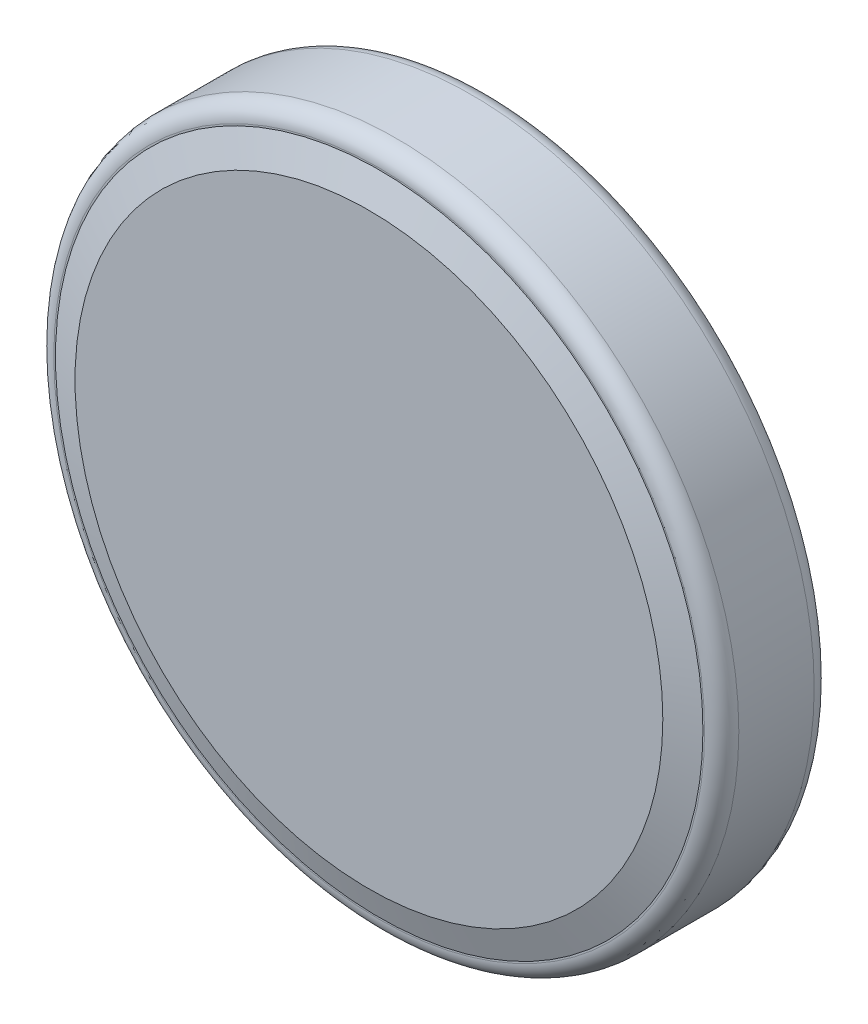
from build123d import *

# Parameters (mm, degrees)
SKETCH1_R           = 10
BOSS_EXTRUDE1_DEPTH = 3.2
SKETCH2_R           = 8
BOSS_EXTRUDE2_DEPTH = 0.3
CHAMFER1_SIZE       = 1.452105439
CHAMFER1_SIZE_2     = 0.5
SKETCH3_W           = 2.2
SKETCH3_H           = 0.6
SKETCH3_W_2         = 0.6
SKETCH3_H_2         = 2.2
CUT_EXTRUDE1_DEPTH  = 0.1
CUT_EXTRUDE2_DEPTH  = 0.1
FILLET1_R           = 0.5


with BuildPart() as part:
    # Sketch1 → Boss-Extrude1 (new body)
    with BuildSketch(Plane.XY):
        Circle(SKETCH1_R)
    extrude(amount=BOSS_EXTRUDE1_DEPTH)

    # Sketch2 → Boss-Extrude2 (add)
    with BuildSketch(Plane.XY.offset(3.2)):
        Circle(SKETCH2_R)
    extrude(amount=BOSS_EXTRUDE2_DEPTH)

    # Chamfer1
    # the kernel refuses this chamfer: 1.452105439, 0.5 mm, written as the material it adds along each edge
    with BuildSketch(Plane(origin=(0, 0, 3.2), x_dir=(1, 0, 0), z_dir=(0, -1, 0))) as chamfer1_piece_1_section:
        Polygon((8 + CHAMFER1_SIZE, 0), (8, CHAMFER1_SIZE_2), (8, 0), align=None)
    chamfer1_piece_1 = revolve(axis=Axis((0, 0, 3.2), (0, 0, 1)), mode=Mode.PRIVATE)
    chamfer1_piece_1 = split(chamfer1_piece_1, bisect_by=Plane(origin=(-9.03518169, 0, 3.5), z_dir=(0, 0, -1)), keep=Keep.TOP, mode=Mode.PRIVATE)
    add(chamfer1_piece_1)

    # Sketch3 → Cut-Extrude1 (cut)
    with BuildSketch(Plane(origin=(0, 0, 0), x_dir=(-1, 0, 0), z_dir=(0, 0, -1))):
        with Locations((1.4, 6)):
            Rectangle(SKETCH3_W, SKETCH3_H)
        with Locations((0, 7.4)):
            Rectangle(SKETCH3_W_2, SKETCH3_H_2)
        with Locations((-1.4, 6)):
            Rectangle(SKETCH3_W, SKETCH3_H)
        with Locations((0, 6)):
            Rectangle(SKETCH3_W_2, SKETCH3_H)
        with Locations((0, 4.6)):
            Rectangle(SKETCH3_W_2, SKETCH3_H_2)
    extrude(amount=-CUT_EXTRUDE1_DEPTH, mode=Mode.SUBTRACT)

    # Sketch5 → Cut-Extrude2 (cut)
    # profile 1 of 8: a face of its own
    with BuildSketch(Plane(origin=(0, 0, 0), x_dir=(-1, 0, 0), z_dir=(0, 0, -1))):
        with BuildLine():
            Line((-5.16025641, 1.397039927), (-5.435096154, 1.186703389))
            add(Edge.make_bspline(
                [(-5.435096154, 1.186703389), (-5.454702042, 1.210069358), (-5.493649489, 1.256486274), (-5.556308692, 1.321665819), (-5.621610334, 1.38273108), (-5.689529456, 1.43997296), (-5.761288575, 1.491389725), (-5.835149374, 1.539660828), (-5.912347419, 1.582928566), (-6.019099154, 1.635391552), (-6.158747002, 1.690137707), (-6.334541841, 1.736040939), (-6.51805294, 1.765262114), (-6.643250539, 1.768426956), (-6.70693109, 1.770036722)],
                knots=[0, 0, 0, 0, 0.757959112, 1.505699292, 2.245454638, 2.979532153, 3.711538275, 4.438200793, 5.171680507, 5.909471876, 7.393775596, 8.890124382, 10.418191784, 12, 12, 12, 12], degree=3))
            add(Edge.make_bspline(
                [(-6.70693109, 1.770036722), (-6.742014389, 1.769632759), (-6.811855382, 1.768828584), (-6.915503855, 1.758219458), (-7.017216906, 1.743308248), (-7.116928373, 1.721182925), (-7.214511331, 1.693210306), (-7.310603733, 1.659784892), (-7.403814333, 1.618430052), (-7.495432571, 1.572721792), (-7.583211782, 1.521094348), (-7.66626683, 1.464780996), (-7.744294798, 1.404411899), (-7.81735741, 1.339760793), (-7.885529358, 1.271118832), (-7.948316669, 1.197754491), (-8.005502079, 1.119902317), (-8.058219104, 1.03858891), (-8.105431838, 0.954051118), (-8.144961717, 0.865976048), (-8.179966839, 0.775871945), (-8.207666082, 0.682720784), (-8.229590599, 0.587178018), (-8.244718262, 0.48898723), (-8.255206733, 0.38835355), (-8.25600691, 0.320144238), (-8.256410256, 0.285761882)],
                knots=[0, 0, 0, 0, 1.054917814, 2.100044995, 3.131103042, 4.146048494, 5.169673617, 6.183595914, 7.203665975, 8.234915748, 9.262203917, 10.264457458, 11.251630812, 12.227803204, 13.197192746, 14.159520551, 15.12972552, 16.100847026, 17.073214652, 18.039054194, 19.002613845, 19.979014051, 20.95965708, 21.949030935, 22.966165397, 24, 24, 24, 24], degree=3))
            add(Edge.make_bspline(
                [(-8.256410256, 0.285761882), (-8.255148437, 0.234030562), (-8.252671023, 0.132462977), (-8.230622689, -0.016307633), (-8.197117598, -0.158828307), (-8.146902021, -0.294208149), (-8.08498297, -0.424116507), (-8.006742359, -0.546355361), (-7.916125821, -0.662771925), (-7.811851402, -0.770614873), (-7.697445586, -0.869128598), (-7.574697674, -0.95587918), (-7.443913387, -1.028194062), (-7.306536756, -1.088370009), (-7.161510642, -1.134626736), (-7.00909584, -1.16719086), (-6.849623845, -1.18843304), (-6.740654445, -1.190466728), (-6.685196314, -1.19150174)],
                knots=[0, 0, 0, 0, 1.029171465, 2.020641659, 2.987623507, 3.938342917, 4.889210282, 5.84687017, 6.821220943, 7.821438502, 8.827599549, 9.822697543, 10.807740252, 11.797342354, 12.80366471, 13.83203677, 14.896651826, 16, 16, 16, 16], degree=3))
            add(Edge.make_bspline(
                [(-6.685196314, -1.19150174), (-6.624093625, -1.18981296), (-6.503828916, -1.186489037), (-6.32746089, -1.158329788), (-6.158625124, -1.11267187), (-5.997312538, -1.048773948), (-5.843977891, -0.96570866), (-5.698381231, -0.865010783), (-5.560399661, -0.74572245), (-5.477428378, -0.654639322), (-5.435096154, -0.608168406)],
                knots=[0, 0, 0, 0, 1.028121516, 2.023589091, 2.998037872, 3.967518031, 4.937445131, 5.927275754, 6.942489185, 8, 8, 8, 8], degree=3))
            Line((-5.435096154, -0.608168406), (-5.16025641, -0.816401579))
            add(Edge.make_bspline(
                [(-5.16025641, -0.816401579), (-5.18237452, -0.844940031), (-5.226504795, -0.901880238), (-5.297962812, -0.982151947), (-5.37324011, -1.057655983), (-5.45289582, -1.127783604), (-5.536013611, -1.19393807), (-5.624085924, -1.254239901), (-5.715954956, -1.309530785), (-5.811309435, -1.36015771), (-5.910048048, -1.405074957), (-6.012052483, -1.443528724), (-6.116883058, -1.476653614), (-6.224544567, -1.503905551), (-6.335260324, -1.525176635), (-6.448630798, -1.539396309), (-6.564900673, -1.549138224), (-6.643342094, -1.55002614), (-6.683092949, -1.550476099)],
                knots=[0, 0, 0, 0, 0.986787822, 1.968848986, 2.935600012, 3.899624008, 4.868462664, 5.837806735, 6.815139263, 7.798259679, 8.787526145, 9.778297419, 10.776456485, 11.791383307, 12.812564526, 13.85620153, 14.913611965, 16, 16, 16, 16], degree=3))
            add(Edge.make_bspline(
                [(-6.683092949, -1.550476099), (-6.720736616, -1.550214106), (-6.795172306, -1.549696048), (-6.905071057, -1.541303881), (-7.012060638, -1.529854144), (-7.115835264, -1.512614013), (-7.216961239, -1.492269673), (-7.314521824, -1.464998416), (-7.409477034, -1.434449249), (-7.501445375, -1.398544263), (-7.590505075, -1.35802808), (-7.676368886, -1.312236521), (-7.758997318, -1.261554657), (-7.839202739, -1.207099646), (-7.915800323, -1.147122344), (-7.989453848, -1.08245571), (-8.060576324, -1.013317699), (-8.104579009, -0.963462846), (-8.126702724, -0.938396772)],
                knots=[0, 0, 0, 0, 1.114604814, 2.203992996, 3.262667896, 4.300477797, 5.318619304, 6.316056647, 7.298880507, 8.271930387, 9.238335007, 10.195173496, 11.151986948, 12.108099108, 13.064862484, 14.031167946, 15.010108607, 16, 16, 16, 16], degree=3))
            add(Edge.make_bspline(
                [(-8.126702724, -0.938396772), (-8.162138368, -0.894855583), (-8.232581845, -0.808298872), (-8.322707528, -0.668012891), (-8.399855083, -0.521544682), (-8.462231004, -0.368124753), (-8.510993737, -0.208097366), (-8.544774932, -0.041381852), (-8.566726537, 0.13186609), (-8.569236826, 0.249702879), (-8.570512821, 0.309600023)],
                knots=[0, 0, 0, 0, 0.994628077, 1.977248131, 2.950237994, 3.925870899, 4.908910175, 5.911660606, 6.938484602, 8, 8, 8, 8], degree=3))
            add(Edge.make_bspline(
                [(-8.570512821, 0.309600023), (-8.568957627, 0.372555477), (-8.565897881, 0.496416401), (-8.539902085, 0.678190355), (-8.498083289, 0.852341753), (-8.4386864, 1.018545498), (-8.363381049, 1.177675778), (-8.270354435, 1.328516983), (-8.160687293, 1.472033783), (-8.035239725, 1.606048534), (-7.89767239, 1.728587887), (-7.750353576, 1.83639409), (-7.593571629, 1.926111606), (-7.429053778, 2.001107769), (-7.255568096, 2.058752232), (-7.073484727, 2.099105419), (-6.883145812, 2.124222535), (-6.753283386, 2.127397743), (-6.687299679, 2.129011081)],
                knots=[0, 0, 0, 0, 1.032925535, 2.032216505, 3.007276963, 3.968222605, 4.92396291, 5.891752235, 6.871517503, 7.883894988, 8.900124299, 9.891468569, 10.874487609, 11.85992873, 12.854644235, 13.869047385, 14.917252991, 16, 16, 16, 16], degree=3))
            add(Edge.make_bspline(
                [(-6.687299679, 2.129011081), (-6.647085208, 2.128528943), (-6.56748471, 2.127574599), (-6.449732058, 2.118268457), (-6.335089731, 2.10275485), (-6.223478749, 2.081638781), (-6.114356133, 2.055431459), (-6.008555892, 2.021291161), (-5.905457205, 1.982254629), (-5.805710297, 1.937296164), (-5.709793747, 1.886829422), (-5.617737428, 1.831413799), (-5.530272569, 1.771117993), (-5.446783721, 1.706454818), (-5.36866751, 1.636056258), (-5.293706031, 1.561858662), (-5.224444953, 1.481724838), (-5.181691758, 1.425319904), (-5.16025641, 1.397039927)],
                knots=[0, 0, 0, 0, 1.096760587, 2.17092713, 3.219439832, 4.250915756, 5.268269357, 6.278326846, 7.281116186, 8.274029601, 9.260640565, 10.235837813, 11.203064059, 12.156899882, 13.114053108, 14.069676657, 15.032185724, 16, 16, 16, 16], degree=3))
        make_face()
    # profile 2 of 8: a face of its own
    with BuildSketch(Plane(origin=(0, 0, 0), x_dir=(-1, 0, 0), z_dir=(0, 0, -1))):
        with BuildLine():
            Line((-4.442307692, 2.039267491), (-3.741887019, 2.039267491))
            add(Edge.make_bspline(
                [(-3.741887019, 2.039267491), (-3.695145891, 2.039111905), (-3.605397746, 2.038813163), (-3.476824476, 2.0371474), (-3.359997379, 2.032373044), (-3.25497754, 2.028264461), (-3.161766885, 2.020772519), (-3.080079594, 2.013611872), (-3.010291896, 2.004238212), (-2.968046045, 1.995532789), (-2.948918269, 1.991591209)],
                knots=[0, 0, 0, 0, 1.410062039, 2.707475311, 3.878576406, 4.937260626, 5.877586885, 6.699081471, 7.410979367, 8, 8, 8, 8], degree=3))
            add(Edge.make_bspline(
                [(-2.948918269, 1.991591209), (-2.923311645, 1.985264444), (-2.872644656, 1.97274588), (-2.79969459, 1.946286279), (-2.730180266, 1.915666655), (-2.664390441, 1.879702934), (-2.60265465, 1.838128155), (-2.544336339, 1.791660032), (-2.489170876, 1.740552826), (-2.439389246, 1.683517985), (-2.392450194, 1.623681475), (-2.352861568, 1.558977718), (-2.318735088, 1.491316191), (-2.291564571, 1.420008773), (-2.269686597, 1.345747001), (-2.254260358, 1.267858205), (-2.24500917, 1.18669723), (-2.244067315, 1.131339321), (-2.243589744, 1.103269895)],
                knots=[0, 0, 0, 0, 1.027469482, 2.033020251, 3.019912614, 3.986113645, 4.951240523, 5.91722682, 6.890402269, 7.87763091, 8.8651537, 9.85103654, 10.82876324, 11.815024772, 12.821070561, 13.842952187, 14.906261191, 16, 16, 16, 16], degree=3))
            add(Edge.make_bspline(
                [(-2.243589744, 1.103269895), (-2.245058742, 1.05663479), (-2.247925137, 0.965637623), (-2.274650241, 0.833576741), (-2.318426761, 0.710387426), (-2.37875005, 0.596224789), (-2.455569526, 0.493314143), (-2.547894317, 0.402923688), (-2.655775928, 0.327283775), (-2.756205244, 0.274830971), (-2.844919444, 0.241238062), (-2.917952757, 0.217601703), (-2.997619734, 0.199339738), (-3.083157069, 0.182979606), (-3.174920724, 0.170627912), (-3.272690764, 0.161581317), (-3.376536915, 0.155927269), (-3.447875985, 0.155085264), (-3.484575321, 0.154652107)],
                knots=[0, 0, 0, 0, 1.260483769, 2.459530307, 3.627416485, 4.787058657, 5.939039949, 7.08810263, 8.267026773, 9.491475466, 10.141966685, 10.831826277, 11.566392101, 12.351337768, 13.187381173, 14.07005841, 15.007169909, 16, 16, 16, 16], degree=3))
            Line((-3.484575321, 0.154652107), (-2.198717949, -1.460732509))
            Line((-2.198717949, -1.460732509), (-2.587139423, -1.460732509))
            Line((-2.587139423, -1.460732509), (-3.872996795, 0.154652107))
            Line((-3.872996795, 0.154652107), (-4.128205128, 0.154652107))
            Line((-4.128205128, 0.154652107), (-4.128205128, -1.460732509))
            Line((-4.128205128, -1.460732509), (-4.442307692, -1.460732509))
            Line((-4.442307692, -1.460732509), (-4.442307692, 2.039267491))
        make_face()
        with BuildLine():
            Line((-4.128205128, 1.680293132), (-4.128205128, 0.513626466))
            Line((-4.128205128, 0.513626466), (-3.487379808, 0.508718613))
            add(Edge.make_bspline(
                [(-3.487379808, 0.508718613), (-3.457459769, 0.508705376), (-3.399466212, 0.50867972), (-3.315565547, 0.512673496), (-3.237445435, 0.517216814), (-3.165404683, 0.52416616), (-3.099411108, 0.533122232), (-3.039497694, 0.544325216), (-2.985566643, 0.557377279), (-2.922668104, 0.577578904), (-2.852431573, 0.609584923), (-2.776100113, 0.656150421), (-2.711097775, 0.714719541), (-2.656179913, 0.781692997), (-2.612050481, 0.855329245), (-2.580938427, 0.934745615), (-2.561195985, 1.017937213), (-2.558867439, 1.07511532), (-2.557692308, 1.103971017)],
                knots=[0, 0, 0, 0, 1.146690395, 2.22261258, 3.21895312, 4.145990853, 4.996080663, 5.770904154, 6.481378293, 7.121626537, 8.300444488, 9.431385265, 10.535395872, 11.636531494, 12.74115979, 13.810798291, 14.895190096, 16, 16, 16, 16], degree=3))
            add(Edge.make_bspline(
                [(-2.557692308, 1.103971017), (-2.558894429, 1.132117591), (-2.561276594, 1.187893829), (-2.580725363, 1.26954974), (-2.613614744, 1.34661669), (-2.657936982, 1.418781175), (-2.711936137, 1.484286911), (-2.77525395, 1.540334064), (-2.846159145, 1.586583528), (-2.912430343, 1.616137909), (-2.971664556, 1.634257762), (-3.023094216, 1.647008926), (-3.081205693, 1.657253395), (-3.146281152, 1.665461456), (-3.218042783, 1.6725164), (-3.296853434, 1.677268179), (-3.382190214, 1.680082043), (-3.441337145, 1.680221132), (-3.471955128, 1.680293132)],
                knots=[0, 0, 0, 0, 1.101028733, 2.181837193, 3.264309656, 4.369019818, 5.486613113, 6.575447106, 7.666700264, 8.788928104, 9.402425223, 10.0903467, 10.862060571, 11.710948788, 12.657782767, 13.684531032, 14.801375019, 16, 16, 16, 16], degree=3))
            Line((-3.471955128, 1.680293132), (-4.128205128, 1.680293132))
        make_face(mode=Mode.SUBTRACT)
    # profile 3 of 8: a face of its own
    with BuildSketch(Plane(origin=(0, 0, 0), x_dir=(-1, 0, 0), z_dir=(0, 0, -1))):
        with BuildLine():
            Line((-1.346153846, 0.962344414), (-1.66025641, 0.962344414))
            add(Edge.make_bspline(
                [(-1.66025641, 0.962344414), (-1.658209257, 1.004015302), (-1.654188703, 1.085855817), (-1.635360414, 1.205179723), (-1.608419537, 1.319234522), (-1.570328083, 1.427104436), (-1.523021805, 1.529743243), (-1.466291778, 1.626743259), (-1.399097927, 1.717734447), (-1.322891193, 1.801873291), (-1.240122554, 1.879060861), (-1.150816615, 1.945716104), (-1.056971587, 2.002033776), (-0.958872188, 2.049115017), (-0.855411625, 2.084454863), (-0.747528767, 2.110676503), (-0.63474963, 2.126452849), (-0.557909608, 2.128148634), (-0.518830128, 2.129011081)],
                knots=[0, 0, 0, 0, 1.10065271, 2.161652631, 3.183658789, 4.190468796, 5.17591951, 6.163126047, 7.15150782, 8.156236427, 9.156009102, 10.134482811, 11.092018607, 12.041330605, 13.001268258, 13.972401359, 14.968799086, 16, 16, 16, 16], degree=3))
            add(Edge.make_bspline(
                [(-0.518830128, 2.129011081), (-0.480452054, 2.128112624), (-0.405040509, 2.12634719), (-0.294978495, 2.11118616), (-0.190201201, 2.087440569), (-0.090913434, 2.054125152), (0.002092631, 2.009340725), (0.089515675, 1.955543186), (0.172396486, 1.893323355), (0.24700327, 1.820069542), (0.315511349, 1.741867157), (0.374613604, 1.658379254), (0.425226767, 1.572149968), (0.467414447, 1.482521766), (0.498470586, 1.388650738), (0.522048794, 1.291903535), (0.535376208, 1.191278724), (0.537421631, 1.123172168), (0.538461538, 1.088546337)],
                knots=[0, 0, 0, 0, 1.111607364, 2.184268762, 3.212621178, 4.221274766, 5.211760367, 6.196651075, 7.1921475, 8.207485113, 9.220403448, 10.201281604, 11.166441695, 12.114753415, 13.065576456, 14.026450734, 14.996634279, 16, 16, 16, 16], degree=3))
            add(Edge.make_bspline(
                [(0.538461538, 1.088546337), (0.536768276, 1.039798503), (0.533411464, 0.943158289), (0.504697088, 0.801143426), (0.459850577, 0.663550007), (0.40585322, 0.552812705), (0.351380776, 0.463579211), (0.302293268, 0.390110507), (0.244828457, 0.311005038), (0.178149959, 0.226527701), (0.103637087, 0.136016796), (0.020614924, 0.039527), (-0.071508558, -0.06194477), (-0.136167059, -0.131250371), (-0.169671474, -0.167162797)],
                knots=[0, 0, 0, 0, 1.184426356, 2.348067706, 3.509069118, 4.696110526, 5.333549288, 6.050745305, 6.844228056, 7.710549037, 8.667450064, 9.695053472, 10.805634456, 12, 12, 12, 12], degree=3))
            Line((-0.169671474, -0.167162797), (-1.045372596, -1.10175815))
            Line((-1.045372596, -1.10175815), (0.583333333, -1.10175815))
            Line((0.583333333, -1.10175815), (0.583333333, -1.460732509))
            Line((0.583333333, -1.460732509), (-1.794871795, -1.460732509))
            Line((-1.794871795, -1.460732509), (-0.4375, -0.012214881))
            add(Edge.make_bspline(
                [(-0.4375, -0.012214881), (-0.404452113, 0.022283426), (-0.340973886, 0.088547613), (-0.251191309, 0.185290573), (-0.170552321, 0.275040113), (-0.098534928, 0.357626662), (-0.036701423, 0.43425823), (0.018170809, 0.502452933), (0.0621364, 0.565207384), (0.109851796, 0.637947997), (0.156065777, 0.726760315), (0.195778133, 0.835294004), (0.219992982, 0.947021257), (0.222897817, 1.022523294), (0.224358974, 1.060501466)],
                knots=[0, 0, 0, 0, 1.329631726, 2.553950428, 3.673215718, 4.687767853, 5.603093632, 6.413772471, 7.123043292, 7.734684054, 8.834405432, 9.900288307, 10.943827018, 12, 12, 12, 12], degree=3))
            add(Edge.make_bspline(
                [(0.224358974, 1.060501466), (0.223723232, 1.084382864), (0.222470306, 1.131448514), (0.211412609, 1.200454273), (0.194702102, 1.267019087), (0.170756844, 1.331347706), (0.139150104, 1.392793358), (0.100676724, 1.451430839), (0.056286661, 1.508119804), (0.004935392, 1.561273102), (-0.051476128, 1.609954307), (-0.111070378, 1.653078393), (-0.174120482, 1.689117504), (-0.240360604, 1.718661001), (-0.309606074, 1.741836382), (-0.381990819, 1.757894961), (-0.457314835, 1.767977445), (-0.508748331, 1.769341617), (-0.534955929, 1.770036722)],
                knots=[0, 0, 0, 0, 0.991446411, 1.95395049, 2.89581595, 3.838931463, 4.798493298, 5.75982156, 6.748411868, 7.785213223, 8.824556874, 9.840280684, 10.836137867, 11.835679398, 12.848801643, 13.863922112, 14.911575587, 16, 16, 16, 16], degree=3))
            add(Edge.make_bspline(
                [(-0.534955929, 1.770036722), (-0.562326762, 1.76932169), (-0.616078558, 1.767917484), (-0.694997591, 1.75809482), (-0.770283369, 1.74114898), (-0.842125272, 1.717972306), (-0.910644858, 1.688513757), (-0.975508902, 1.651822012), (-1.036571791, 1.608038519), (-1.093948314, 1.558397963), (-1.146812293, 1.503130361), (-1.193259169, 1.441520398), (-1.233843183, 1.374692983), (-1.269252417, 1.302828432), (-1.298008107, 1.225274652), (-1.319981257, 1.142306948), (-1.337368104, 1.054285566), (-1.343176625, 0.993500481), (-1.346153846, 0.962344414)],
                knots=[0, 0, 0, 0, 1.031018746, 2.02475058, 2.990194455, 3.934040569, 4.864654155, 5.795059489, 6.735614925, 7.690564532, 8.649604399, 9.611025574, 10.590972636, 11.591080095, 12.624614302, 13.701020113, 14.821632451, 16, 16, 16, 16], degree=3))
        make_face()
    # profile 4 of 8: a face of its own
    with BuildSketch(Plane(origin=(0, 0, 0), x_dir=(-1, 0, 0), z_dir=(0, 0, -1))):
        with BuildLine():
            add(Edge.make_bspline(
                [(0.897435897, 0.287865248), (0.897763916, 0.343962635), (0.898401096, 0.45293262), (0.905489517, 0.611717262), (0.917264859, 0.760677551), (0.933402232, 0.899820617), (0.953040212, 1.029182381), (0.979255699, 1.148417138), (1.009068501, 1.258076745), (1.043620947, 1.358518793), (1.082608736, 1.451096496), (1.125042997, 1.537521698), (1.172607791, 1.61766363), (1.222584704, 1.692801421), (1.276996776, 1.761705115), (1.334295566, 1.825347778), (1.396717442, 1.882258528), (1.462140451, 1.934104831), (1.531156915, 1.979554302), (1.601799581, 2.019587041), (1.674554687, 2.053786908), (1.74962087, 2.080677344), (1.826323428, 2.102888191), (1.904930495, 2.118077138), (1.985571858, 2.127634047), (2.040003293, 2.128547715), (2.067608173, 2.129011081)],
                knots=[0, 0, 0, 0, 1.646270934, 3.197905019, 4.663502075, 6.030701355, 7.308322542, 8.50163776, 9.611534131, 10.641858119, 11.616356847, 12.558055219, 13.465016945, 14.349605745, 15.204443733, 16.039544428, 16.859896111, 17.680448484, 18.487036065, 19.28249412, 20.06191084, 20.843045899, 21.620316918, 22.403196591, 23.190181807, 24, 24, 24, 24], degree=3))
            add(Edge.make_bspline(
                [(2.067608173, 2.129011081), (2.095443652, 2.128523266), (2.15079966, 2.127553155), (2.232640036, 2.118229212), (2.312589717, 2.102758089), (2.390307856, 2.080837115), (2.466432843, 2.053641438), (2.54036925, 2.019554321), (2.612576332, 1.979875454), (2.681906619, 1.933251576), (2.749121235, 1.8812693), (2.812569198, 1.822506631), (2.872256284, 1.757556912), (2.928931589, 1.687115048), (2.980987186, 1.609829963), (3.030560618, 1.527045853), (3.074932654, 1.437314989), (3.11766733, 1.342134521), (3.154554316, 1.238870862), (3.187820562, 1.128106101), (3.21469953, 1.008531915), (3.237088802, 0.880775669), (3.254433698, 0.744368186), (3.26706634, 0.599601871), (3.273739426, 0.44638148), (3.274996127, 0.341623631), (3.275641026, 0.287865248)],
                knots=[0, 0, 0, 0, 0.810914788, 1.612654377, 2.396697861, 3.181598691, 3.963628158, 4.749916497, 5.551656086, 6.361998678, 7.18212741, 8.025565596, 8.878627764, 9.750805457, 10.657531673, 11.591944965, 12.560506719, 13.57287815, 14.630710178, 15.753379473, 16.941251878, 18.199788006, 19.531962791, 20.947069417, 22.433333509, 24, 24, 24, 24], degree=3))
            add(Edge.make_bspline(
                [(3.275641026, 0.287865248), (3.274989441, 0.23434134), (3.273719855, 0.130052188), (3.267141148, -0.022478788), (3.254182517, -0.166476831), (3.237972529, -0.302287293), (3.215521566, -0.429344912), (3.1879164, -0.548089361), (3.157266077, -0.659033432), (3.119431283, -0.761268244), (3.078020572, -0.856219967), (3.032965376, -0.944887115), (2.98469555, -1.028053408), (2.932106805, -1.105053155), (2.876053392, -1.176431812), (2.815335603, -1.240929434), (2.751665018, -1.300100106), (2.684252602, -1.352751734), (2.613841051, -1.398836538), (2.541881974, -1.440050389), (2.467098591, -1.473283084), (2.391185638, -1.501818125), (2.313057272, -1.523618577), (2.232810881, -1.538692432), (2.150854645, -1.549264281), (2.09545308, -1.550070761), (2.067608173, -1.550476099)],
                knots=[0, 0, 0, 0, 1.561518951, 3.042555995, 4.452378317, 5.7783523, 7.031515105, 8.214008947, 9.334062868, 10.386615937, 11.391082383, 12.354592575, 13.286541444, 14.194233754, 15.072674879, 15.931287219, 16.775624067, 17.606195743, 18.42308326, 19.229000347, 20.022332153, 20.807536673, 21.593273796, 22.3848459, 23.188221202, 24, 24, 24, 24], degree=3))
            add(Edge.make_bspline(
                [(2.067608173, -1.550476099), (2.040004059, -1.550009743), (1.985574134, -1.549090181), (1.904921709, -1.53957645), (1.826639265, -1.524280946), (1.750340511, -1.502864342), (1.675633996, -1.476649506), (1.60353771, -1.442495822), (1.533250026, -1.403161753), (1.46495847, -1.358366332), (1.399946309, -1.307044649), (1.337847704, -1.25028036), (1.280222685, -1.186656949), (1.226588589, -1.117179026), (1.175614501, -1.042485783), (1.128725127, -0.96155741), (1.085354273, -0.8747148), (1.045710783, -0.781396889), (1.010562119, -0.680241961), (0.979514411, -0.570092783), (0.955000254, -0.449977147), (0.934017298, -0.32085978), (0.917092915, -0.182185849), (0.90553859, -0.033880071), (0.898397275, 0.123965138), (0.897762204, 0.232234912), (0.897435897, 0.287865248)],
                knots=[0, 0, 0, 0, 0.810891512, 1.598919785, 2.382837074, 3.152667961, 3.926044502, 4.706494248, 5.493654104, 6.291793342, 7.103789334, 7.925228297, 8.761435821, 9.622817696, 10.50288917, 11.416980706, 12.369136599, 13.353924996, 14.394355917, 15.514179734, 16.714354668, 17.994756427, 19.357759367, 20.818452758, 22.365282078, 24, 24, 24, 24], degree=3))
        make_face()
        with BuildLine():
            add(Edge.make_bspline(
                [(1.211538462, 0.289267491), (1.211657909, 0.242518792), (1.211889732, 0.151788748), (1.217945932, 0.019945487), (1.226196164, -0.103024842), (1.236837462, -0.217278379), (1.25264041, -0.322428391), (1.270347198, -0.419198074), (1.291895288, -0.507075311), (1.317390306, -0.586663122), (1.346429402, -0.659312191), (1.378135266, -0.726913406), (1.412195989, -0.790265342), (1.45031514, -0.84879895), (1.491830203, -0.902705115), (1.535803462, -0.952937947), (1.583876046, -0.997734928), (1.650379789, -1.051461783), (1.738176263, -1.106980917), (1.848796718, -1.155327007), (1.962465169, -1.185709463), (2.039616419, -1.189573219), (2.078125, -1.19150174)],
                knots=[0, 0, 0, 0, 1.459021318, 2.831673884, 4.118529203, 5.306027144, 6.411944654, 7.436330062, 8.375795394, 9.233974572, 10.042671642, 10.816086306, 11.563610507, 12.285937304, 12.993564865, 13.685989202, 14.367179055, 15.041617293, 16.353048772, 17.594441528, 18.799311195, 20, 20, 20, 20], degree=3))
            add(Edge.make_bspline(
                [(2.078125, -1.19150174), (2.116882672, -1.189903959), (2.194317995, -1.186711696), (2.30745179, -1.155912959), (2.41728206, -1.109443419), (2.503354, -1.054495914), (2.568836544, -1.002167584), (2.615753534, -0.957552936), (2.658815582, -0.907597069), (2.699657657, -0.853697773), (2.737116733, -0.794825289), (2.771179871, -0.731262713), (2.802263218, -0.662833535), (2.819972264, -0.615063796), (2.829026442, -0.590640361)],
                knots=[0, 0, 0, 0, 1.353760809, 2.704726607, 4.075137775, 5.516104923, 6.260822281, 7.007110065, 7.778089737, 8.566572457, 9.372053459, 10.217411131, 11.088608312, 12, 12, 12, 12], degree=3))
            add(Edge.make_bspline(
                [(2.829026442, -0.590640361), (2.83957821, -0.559410622), (2.861002824, -0.496000858), (2.888614598, -0.397637206), (2.910359997, -0.294434442), (2.929923363, -0.187009325), (2.943276419, -0.074569624), (2.954024232, 0.04253676), (2.960354919, 0.164398122), (2.96113967, 0.247193113), (2.961538462, 0.289267491)],
                knots=[0, 0, 0, 0, 0.884706709, 1.796334032, 2.740027952, 3.714592787, 4.726048262, 5.777819803, 6.87074269, 8, 8, 8, 8], degree=3))
            add(Edge.make_bspline(
                [(2.961538462, 0.289267491), (2.960988272, 0.331335064), (2.959911985, 0.413628228), (2.955797997, 0.534146409), (2.945174422, 0.64861417), (2.933375303, 0.757524643), (2.915978082, 0.860274945), (2.897220276, 0.957725251), (2.872019063, 1.048668276), (2.845099288, 1.134527857), (2.814288893, 1.214328512), (2.780373158, 1.288442298), (2.7441514, 1.357227023), (2.704809159, 1.420493964), (2.662813476, 1.478526507), (2.617055927, 1.530161102), (2.569351554, 1.57699807), (2.502534368, 1.630460639), (2.415060079, 1.684972335), (2.306214431, 1.735138094), (2.192943787, 1.763946387), (2.116370333, 1.768008074), (2.078125, 1.770036722)],
                knots=[0, 0, 0, 0, 1.31362396, 2.569729283, 3.763502607, 4.902122613, 5.988968491, 7.01645872, 7.998833611, 8.933434873, 9.825090667, 10.667526885, 11.477055099, 12.250526234, 12.991942729, 13.710640831, 14.402115721, 15.076753259, 16.378508321, 17.609869233, 18.806226677, 20, 20, 20, 20], degree=3))
            add(Edge.make_bspline(
                [(2.078125, 1.770036722), (2.039414408, 1.768005275), (1.961922702, 1.763938681), (1.847474748, 1.735245428), (1.737770396, 1.685232462), (1.650527421, 1.630280089), (1.583663635, 1.577941778), (1.536580941, 1.532555324), (1.492434769, 1.482909069), (1.451767069, 1.428507155), (1.413677786, 1.370041787), (1.378696773, 1.307053022), (1.347179444, 1.239221658), (1.318094907, 1.166605223), (1.292522119, 1.087024278), (1.271428156, 0.999255285), (1.251941103, 0.902793393), (1.238145834, 0.797073885), (1.225882078, 0.682791732), (1.21800073, 0.559514413), (1.211869473, 0.427450033), (1.211651009, 0.336250875), (1.211538462, 0.289267491)],
                knots=[0, 0, 0, 0, 1.207732386, 2.417664972, 3.655092373, 4.956220595, 5.625982001, 6.301752483, 6.994047911, 7.697131622, 8.419323945, 9.170223765, 9.943494443, 10.752040957, 11.610060368, 12.549350801, 13.567764191, 14.679664412, 15.874934091, 17.154273443, 18.533957287, 20, 20, 20, 20], degree=3))
        make_face(mode=Mode.SUBTRACT)
    # profile 5 of 8: a face of its own
    with BuildSketch(Plane(origin=(0, 0, 0), x_dir=(-1, 0, 0), z_dir=(0, 0, -1))):
        with BuildLine():
            Line((4.038461538, 1.231575184), (3.724358974, 1.231575184))
            add(Edge.make_bspline(
                [(3.724358974, 1.231575184), (3.732868525, 1.266807667), (3.749504001, 1.335684292), (3.784201574, 1.434091553), (3.822000829, 1.527215074), (3.867389934, 1.613311148), (3.916898688, 1.694110051), (3.97362141, 1.767779175), (4.034941132, 1.83619214), (4.102766081, 1.896905378), (4.173894743, 1.951883107), (4.249329363, 1.998758165), (4.327552257, 2.039082317), (4.409105389, 2.072302549), (4.494231561, 2.097328073), (4.582161184, 2.115484879), (4.673124685, 2.127275993), (4.734872275, 2.128426756), (4.766225962, 2.129011081)],
                knots=[0, 0, 0, 0, 1.162005537, 2.271625781, 3.343758855, 4.383309926, 5.390229558, 6.379919256, 7.361854164, 8.333198761, 9.295911338, 10.242430842, 11.177959212, 12.116337295, 13.062827104, 14.020064771, 14.994644689, 16, 16, 16, 16], degree=3))
            add(Edge.make_bspline(
                [(4.766225962, 2.129011081), (4.811908704, 2.127631851), (4.902277715, 2.124903475), (5.035040762, 2.099989039), (5.163067581, 2.060563906), (5.284956828, 2.006090179), (5.398175261, 1.938902866), (5.498911448, 1.858938129), (5.585799959, 1.767738828), (5.658694336, 1.667006263), (5.715769335, 1.559350754), (5.757855709, 1.448550597), (5.78347739, 1.334868625), (5.786797947, 1.258111346), (5.788461538, 1.219656113)],
                knots=[0, 0, 0, 0, 1.083050992, 2.142477498, 3.193116406, 4.255571735, 5.30263384, 6.308962982, 7.297363603, 8.282367274, 9.249857812, 10.179914175, 11.08814088, 12, 12, 12, 12], degree=3))
            add(Edge.make_bspline(
                [(5.788461538, 1.219656113), (5.787297947, 1.182649318), (5.78502098, 1.110232764), (5.765687275, 1.004511267), (5.733151012, 0.904869666), (5.688081249, 0.810888504), (5.629739699, 0.723163664), (5.559067002, 0.641497774), (5.47556434, 0.565528615), (5.412285402, 0.522009142), (5.379707532, 0.49960403)],
                knots=[0, 0, 0, 0, 1.024540389, 2.004866551, 2.965041327, 3.920577974, 4.882998113, 5.874504559, 6.905732034, 8, 8, 8, 8], degree=3))
            add(Edge.make_bspline(
                [(5.379707532, 0.49960403), (5.416939287, 0.481625858), (5.490706161, 0.446005901), (5.59125669, 0.376150143), (5.682534566, 0.295493796), (5.733438285, 0.232551143), (5.759014423, 0.200926145)],
                knots=[0, 0, 0, 0, 1.015518401, 2.012035669, 3.001164323, 4, 4, 4, 4], degree=3))
            add(Edge.make_bspline(
                [(5.759014423, 0.200926145), (5.775855765, 0.177868393), (5.809262661, 0.132130477), (5.850498195, 0.058594051), (5.88790731, -0.015757438), (5.917057529, -0.092916844), (5.939631396, -0.171989858), (5.955767428, -0.253112254), (5.965791569, -0.336350277), (5.967227121, -0.392662757), (5.967948718, -0.420968887)],
                knots=[0, 0, 0, 0, 1.025084078, 2.033381695, 3.024893161, 4.013698104, 4.991890475, 5.976764909, 6.982997093, 8, 8, 8, 8], degree=3))
            add(Edge.make_bspline(
                [(5.967948718, -0.420968887), (5.966154204, -0.469978608), (5.962573622, -0.56776741), (5.930569548, -0.712242132), (5.880956307, -0.853467634), (5.810499371, -0.988542473), (5.724631863, -1.114922854), (5.622474538, -1.227999163), (5.50518813, -1.325197768), (5.374382481, -1.406407996), (5.232665353, -1.471325918), (5.081089761, -1.516383361), (4.921839707, -1.54572936), (4.812632409, -1.548876229), (4.757111378, -1.550476099)],
                knots=[0, 0, 0, 0, 0.955779014, 1.907060117, 2.875433937, 3.871313158, 4.872415639, 5.851225146, 6.836215519, 7.83643374, 8.849228613, 9.86973379, 10.916971861, 12, 12, 12, 12], degree=3))
            add(Edge.make_bspline(
                [(4.757111378, -1.550476099), (4.719692078, -1.549607885), (4.646063373, -1.547899531), (4.537819874, -1.53622093), (4.434498175, -1.514890925), (4.335958577, -1.486187619), (4.242113541, -1.449795877), (4.153249436, -1.404477179), (4.068819542, -1.351165677), (3.989620591, -1.289232089), (3.915662023, -1.21995075), (3.848909299, -1.14209174), (3.788249506, -1.057094336), (3.735306867, -0.96397128), (3.687669915, -0.863926022), (3.648488958, -0.755677524), (3.61400339, -0.640193502), (3.597969925, -0.559715762), (3.58974359, -0.518424816)],
                knots=[0, 0, 0, 0, 1.048658725, 2.063410685, 3.046034179, 4.001477787, 4.936774919, 5.862367409, 6.792675028, 7.730719943, 8.675894397, 9.627829632, 10.600096036, 11.597688215, 12.626045268, 13.701542398, 14.82072376, 16, 16, 16, 16], degree=3))
            Line((3.58974359, -0.518424816), (3.903846154, -0.518424816))
            add(Edge.make_bspline(
                [(3.903846154, -0.518424816), (3.912029445, -0.54537383), (3.927946658, -0.597792001), (3.955040956, -0.673232307), (3.985909228, -0.74239036), (4.019023787, -0.805773482), (4.053802233, -0.864005885), (4.092717158, -0.915547754), (4.132886303, -0.962662956), (4.163165656, -0.989207568), (4.177984776, -1.002198855)],
                knots=[0, 0, 0, 0, 1.198163088, 2.33053128, 3.407730985, 4.417276592, 5.372219308, 6.28897303, 7.162600585, 8, 8, 8, 8], degree=3))
            add(Edge.make_bspline(
                [(4.177984776, -1.002198855), (4.197581352, -1.017307189), (4.236714015, -1.047477221), (4.300482246, -1.085978849), (4.367547132, -1.119339874), (4.439361806, -1.14482357), (4.514376577, -1.166401231), (4.593803942, -1.18052175), (4.676943159, -1.190209921), (4.733710923, -1.191064853), (4.762720353, -1.19150174)],
                knots=[0, 0, 0, 0, 0.946170439, 1.889420265, 2.845303464, 3.807233317, 4.801018734, 5.828864929, 6.890507805, 8, 8, 8, 8], degree=3))
            add(Edge.make_bspline(
                [(4.762720353, -1.19150174), (4.795473855, -1.190885834), (4.859520502, -1.189681485), (4.952975361, -1.178605778), (5.041882809, -1.162475364), (5.125255735, -1.137562382), (5.204186242, -1.10678153), (5.277567892, -1.068133125), (5.346363998, -1.022788403), (5.409693403, -0.971249245), (5.466638911, -0.914827749), (5.516778424, -0.855814678), (5.559403086, -0.794458849), (5.593786664, -0.730420728), (5.620937214, -0.663965499), (5.639420415, -0.59490667), (5.65227193, -0.523809403), (5.653318542, -0.475480435), (5.653846154, -0.451117124)],
                knots=[0, 0, 0, 0, 1.217147791, 2.380027433, 3.494444702, 4.572153297, 5.609568379, 6.639424714, 7.649109417, 8.668170816, 9.669597737, 10.625200337, 11.543417969, 12.441394052, 13.322311151, 14.205496177, 15.095365482, 16, 16, 16, 16], degree=3))
            add(Edge.make_bspline(
                [(5.653846154, -0.451117124), (5.652315852, -0.418505785), (5.649262864, -0.353445377), (5.625954284, -0.257727803), (5.58761542, -0.16550439), (5.533942909, -0.0783486), (5.46860718, 0.002427301), (5.392242273, 0.074498784), (5.304214045, 0.133968875), (5.223194176, 0.175057531), (5.151429019, 0.203094606), (5.090013635, 0.221769571), (5.021257032, 0.237583227), (4.945990683, 0.252295498), (4.863647466, 0.264816846), (4.774317028, 0.275258662), (4.677981267, 0.283613703), (4.611290101, 0.287344798), (4.576923077, 0.289267491)],
                knots=[0, 0, 0, 0, 1.07054697, 2.135767047, 3.216561865, 4.33974944, 5.486079747, 6.621378074, 7.775625952, 8.963672916, 9.598146892, 10.304877434, 11.070270905, 11.915000392, 12.823868403, 13.805723172, 14.86925407, 16, 16, 16, 16], degree=3))
            Line((4.576923077, 0.289267491), (4.576923077, 0.64824185))
            add(Edge.make_bspline(
                [(4.576923077, 0.64824185), (4.620224243, 0.648976654), (4.705040589, 0.650415954), (4.828934894, 0.667823964), (4.947408206, 0.691904592), (5.057834948, 0.728789785), (5.158483661, 0.771630081), (5.245803264, 0.821482291), (5.318570411, 0.87689704), (5.376431482, 0.93872965), (5.419960711, 1.005044697), (5.451787508, 1.074161355), (5.470587835, 1.146685416), (5.473097502, 1.196180084), (5.474358974, 1.221058357)],
                knots=[0, 0, 0, 0, 1.321986639, 2.589447074, 3.816329219, 5.01088745, 6.139805852, 7.153945165, 8.075214402, 8.924034688, 9.728124013, 10.488707548, 11.240355623, 12, 12, 12, 12], degree=3))
            add(Edge.make_bspline(
                [(5.474358974, 1.221058357), (5.473944563, 1.239336102), (5.473120112, 1.275698809), (5.462722835, 1.328823878), (5.447098794, 1.380324823), (5.425619064, 1.429982634), (5.396868866, 1.477452908), (5.362462879, 1.523140357), (5.321494779, 1.566784136), (5.274549332, 1.607464455), (5.224137527, 1.646233692), (5.168887752, 1.679147329), (5.110465877, 1.707292391), (5.048807222, 1.730501893), (4.983711692, 1.747961182), (4.915485134, 1.760497023), (4.843997451, 1.768334678), (4.795225719, 1.769463094), (4.770432692, 1.770036722)],
                knots=[0, 0, 0, 0, 0.884392785, 1.759457502, 2.611959086, 3.489218968, 4.37281399, 5.2945488, 6.255912374, 7.266815255, 8.301784654, 9.332968512, 10.37626691, 11.440494194, 12.520033166, 13.637162961, 14.798855837, 16, 16, 16, 16], degree=3))
            add(Edge.make_bspline(
                [(4.770432692, 1.770036722), (4.730581024, 1.76864536), (4.652741448, 1.765927706), (4.540526531, 1.742124693), (4.436207197, 1.704146609), (4.35646853, 1.65881359), (4.297585956, 1.614063156), (4.255509018, 1.57498077), (4.214188508, 1.531547946), (4.176342831, 1.481089571), (4.138068854, 1.427022781), (4.103224293, 1.366599099), (4.0693646, 1.301394705), (4.048962051, 1.25529907), (4.038461538, 1.231575184)],
                knots=[0, 0, 0, 0, 1.472543308, 2.876219568, 4.221790263, 5.565193594, 6.249813518, 6.953379497, 7.687249741, 8.463570142, 9.283606569, 10.136032583, 11.040678096, 12, 12, 12, 12], degree=3))
        make_face()
    # profile 6 of 8: a face of its own
    with BuildSketch(Plane(origin=(0, 0, 0), x_dir=(-1, 0, 0), z_dir=(0, 0, -1))):
        with BuildLine():
            Line((6.730769231, 0.962344414), (6.416666667, 0.962344414))
            add(Edge.make_bspline(
                [(6.416666667, 0.962344414), (6.41871382, 1.004015302), (6.422734374, 1.085855817), (6.441562663, 1.205179723), (6.46850354, 1.319234522), (6.506594994, 1.427104436), (6.553901272, 1.529743243), (6.610631299, 1.626743259), (6.67782515, 1.717734447), (6.754031884, 1.801873291), (6.836800523, 1.879060861), (6.926106462, 1.945716104), (7.01995149, 2.002033776), (7.118050889, 2.049115017), (7.221511452, 2.084454863), (7.32939431, 2.110676503), (7.442173446, 2.126452849), (7.519013469, 2.128148634), (7.558092949, 2.129011081)],
                knots=[0, 0, 0, 0, 1.10065271, 2.161652631, 3.183658789, 4.190468796, 5.17591951, 6.163126047, 7.15150782, 8.156236427, 9.156009102, 10.134482811, 11.092018607, 12.041330605, 13.001268258, 13.972401359, 14.968799086, 16, 16, 16, 16], degree=3))
            add(Edge.make_bspline(
                [(7.558092949, 2.129011081), (7.596471023, 2.128112624), (7.671882567, 2.12634719), (7.781944582, 2.11118616), (7.886721876, 2.087440569), (7.986009643, 2.054125152), (8.079015707, 2.009340725), (8.166438752, 1.955543186), (8.249319563, 1.893323355), (8.323926346, 1.820069542), (8.392434426, 1.741867157), (8.451536681, 1.658379254), (8.502149844, 1.572149968), (8.544337524, 1.482521766), (8.575393663, 1.388650738), (8.598971871, 1.291903535), (8.612299285, 1.191278724), (8.614344708, 1.123172168), (8.615384615, 1.088546337)],
                knots=[0, 0, 0, 0, 1.111607364, 2.184268762, 3.212621178, 4.221274766, 5.211760367, 6.196651075, 7.1921475, 8.207485113, 9.220403448, 10.201281604, 11.166441695, 12.114753415, 13.065576456, 14.026450734, 14.996634279, 16, 16, 16, 16], degree=3))
            add(Edge.make_bspline(
                [(8.615384615, 1.088546337), (8.613691353, 1.039798503), (8.610334541, 0.943158289), (8.581620165, 0.801143426), (8.536773654, 0.663550007), (8.482776297, 0.552812705), (8.428303853, 0.463579211), (8.379216345, 0.390110507), (8.321751534, 0.311005038), (8.255073036, 0.226527701), (8.180560164, 0.136016796), (8.097538001, 0.039527), (8.005414519, -0.06194477), (7.940756018, -0.131250371), (7.907251603, -0.167162797)],
                knots=[0, 0, 0, 0, 1.184426356, 2.348067706, 3.509069118, 4.696110526, 5.333549288, 6.050745305, 6.844228056, 7.710549037, 8.667450064, 9.695053472, 10.805634456, 12, 12, 12, 12], degree=3))
            Line((7.907251603, -0.167162797), (7.031550481, -1.10175815))
            Line((7.031550481, -1.10175815), (8.66025641, -1.10175815))
            Line((8.66025641, -1.10175815), (8.66025641, -1.460732509))
            Line((8.66025641, -1.460732509), (6.282051282, -1.460732509))
            Line((6.282051282, -1.460732509), (7.639423077, -0.012214881))
            add(Edge.make_bspline(
                [(7.639423077, -0.012214881), (7.672470964, 0.022283426), (7.735949191, 0.088547613), (7.825731768, 0.185290573), (7.906370756, 0.275040113), (7.978388149, 0.357626662), (8.040221654, 0.43425823), (8.095093886, 0.502452933), (8.139059477, 0.565207384), (8.186774873, 0.637947997), (8.232988854, 0.726760315), (8.27270121, 0.835294004), (8.296916059, 0.947021257), (8.299820894, 1.022523294), (8.301282051, 1.060501466)],
                knots=[0, 0, 0, 0, 1.329631726, 2.553950428, 3.673215718, 4.687767853, 5.603093632, 6.413772471, 7.123043292, 7.734684054, 8.834405432, 9.900288307, 10.943827018, 12, 12, 12, 12], degree=3))
            add(Edge.make_bspline(
                [(8.301282051, 1.060501466), (8.300646309, 1.084382864), (8.299393383, 1.131448514), (8.288335685, 1.200454273), (8.271625179, 1.267019087), (8.247679921, 1.331347706), (8.216073181, 1.392793358), (8.177599801, 1.451430839), (8.133209738, 1.508119804), (8.081858469, 1.561273102), (8.025446949, 1.609954307), (7.965852699, 1.653078393), (7.902802595, 1.689117504), (7.836562473, 1.718661001), (7.767317003, 1.741836382), (7.694932258, 1.757894961), (7.619608242, 1.767977445), (7.568174746, 1.769341617), (7.541967147, 1.770036722)],
                knots=[0, 0, 0, 0, 0.991446411, 1.95395049, 2.89581595, 3.838931463, 4.798493298, 5.75982156, 6.748411868, 7.785213223, 8.824556874, 9.840280684, 10.836137867, 11.835679398, 12.848801643, 13.863922112, 14.911575587, 16, 16, 16, 16], degree=3))
            add(Edge.make_bspline(
                [(7.541967147, 1.770036722), (7.514596315, 1.76932169), (7.460844518, 1.767917484), (7.381925486, 1.75809482), (7.306639708, 1.74114898), (7.234797805, 1.717972306), (7.166278219, 1.688513757), (7.101414175, 1.651822012), (7.040351286, 1.608038519), (6.982974763, 1.558397963), (6.930110784, 1.503130361), (6.883663908, 1.441520398), (6.843079894, 1.374692983), (6.80767066, 1.302828432), (6.77891497, 1.225274652), (6.75694182, 1.142306948), (6.739554973, 1.054285566), (6.733746452, 0.993500481), (6.730769231, 0.962344414)],
                knots=[0, 0, 0, 0, 1.031018746, 2.02475058, 2.990194455, 3.934040569, 4.864654155, 5.795059489, 6.735614925, 7.690564532, 8.649604399, 9.611025574, 10.590972636, 11.591080095, 12.624614302, 13.701020113, 14.821632451, 16, 16, 16, 16], degree=3))
        make_face()
    # profile 7 of 8: a face of its own
    with BuildSketch(Plane(origin=(0, 0, 0), x_dir=(-1, 0, 0), z_dir=(0, 0, -1))):
        with BuildLine():
            Line((-2.445512821, -4.083778837), (-2.759615385, -4.083778837))
            add(Edge.make_bspline(
                [(-2.759615385, -4.083778837), (-2.751105834, -4.048546353), (-2.734470358, -3.979669729), (-2.699772785, -3.881262468), (-2.66197353, -3.788138946), (-2.616584425, -3.702042873), (-2.567075671, -3.62124397), (-2.510352949, -3.547574846), (-2.449033227, -3.47916188), (-2.381208278, -3.418448642), (-2.310079616, -3.363470913), (-2.234644996, -3.316595856), (-2.156422102, -3.276271703), (-2.07486897, -3.243051471), (-1.989742798, -3.218025948), (-1.901813174, -3.199869142), (-1.810849674, -3.188078028), (-1.749102084, -3.186927265), (-1.717748397, -3.18634294)],
                knots=[0, 0, 0, 0, 1.162005537, 2.271625781, 3.343758855, 4.383309926, 5.390229558, 6.379919256, 7.361854164, 8.333198761, 9.295911338, 10.242430842, 11.177959212, 12.116337295, 13.062827104, 14.020064771, 14.994644689, 16, 16, 16, 16], degree=3))
            add(Edge.make_bspline(
                [(-1.717748397, -3.18634294), (-1.672065655, -3.18772217), (-1.581696644, -3.190450545), (-1.448933597, -3.215364982), (-1.320906778, -3.254790114), (-1.199017531, -3.309263841), (-1.085799098, -3.376451154), (-0.985062911, -3.456415891), (-0.8981744, -3.547615193), (-0.825280023, -3.648347757), (-0.768205024, -3.756003267), (-0.72611865, -3.866803424), (-0.700496969, -3.980485395), (-0.697176412, -4.057242674), (-0.695512821, -4.095697908)],
                knots=[0, 0, 0, 0, 1.083050992, 2.142477498, 3.193116406, 4.255571735, 5.30263384, 6.308962982, 7.297363603, 8.282367274, 9.249857812, 10.179914175, 11.08814088, 12, 12, 12, 12], degree=3))
            add(Edge.make_bspline(
                [(-0.695512821, -4.095697908), (-0.696676412, -4.132704702), (-0.698953379, -4.205121257), (-0.718287084, -4.310842754), (-0.750823347, -4.410484354), (-0.79589311, -4.504465516), (-0.85423466, -4.592190356), (-0.924907357, -4.673856247), (-1.008410019, -4.749825405), (-1.071688957, -4.793344878), (-1.104266827, -4.815749991)],
                knots=[0, 0, 0, 0, 1.024540389, 2.004866551, 2.965041327, 3.920577974, 4.882998113, 5.874504559, 6.905732034, 8, 8, 8, 8], degree=3))
            add(Edge.make_bspline(
                [(-1.104266827, -4.815749991), (-1.067035072, -4.833728162), (-0.993268198, -4.86934812), (-0.892717669, -4.939203878), (-0.801439793, -5.019860225), (-0.750536074, -5.082802878), (-0.724959936, -5.114427875)],
                knots=[0, 0, 0, 0, 1.015518401, 2.012035669, 3.001164323, 4, 4, 4, 4], degree=3))
            add(Edge.make_bspline(
                [(-0.724959936, -5.114427875), (-0.708118594, -5.137485627), (-0.674711697, -5.183223544), (-0.633476164, -5.25675997), (-0.596067049, -5.331111459), (-0.56691683, -5.408270865), (-0.544342963, -5.487343879), (-0.528206931, -5.568466275), (-0.51818279, -5.651704297), (-0.516747238, -5.708016777), (-0.516025641, -5.736322908)],
                knots=[0, 0, 0, 0, 1.025084078, 2.033381695, 3.024893161, 4.013698104, 4.991890475, 5.976764909, 6.982997093, 8, 8, 8, 8], degree=3))
            add(Edge.make_bspline(
                [(-0.516025641, -5.736322908), (-0.517820155, -5.785332629), (-0.521400737, -5.883121431), (-0.553404811, -6.027596152), (-0.603018052, -6.168821654), (-0.673474988, -6.303896494), (-0.759342496, -6.430276875), (-0.861499821, -6.543353184), (-0.978786229, -6.640551788), (-1.109591878, -6.721762016), (-1.251309006, -6.786679938), (-1.402884598, -6.831737381), (-1.562134652, -6.861083381), (-1.67134195, -6.86423025), (-1.726862981, -6.865830119)],
                knots=[0, 0, 0, 0, 0.955779014, 1.907060117, 2.875433937, 3.871313158, 4.872415639, 5.851225146, 6.836215519, 7.83643374, 8.849228613, 9.86973379, 10.916971861, 12, 12, 12, 12], degree=3))
            add(Edge.make_bspline(
                [(-1.726862981, -6.865830119), (-1.764282281, -6.864961906), (-1.837910986, -6.863253552), (-1.946154485, -6.85157495), (-2.049476184, -6.830244945), (-2.148015782, -6.80154164), (-2.241860818, -6.765149898), (-2.330724923, -6.7198312), (-2.415154817, -6.666519698), (-2.494353768, -6.60458611), (-2.568312336, -6.53530477), (-2.63506506, -6.45744576), (-2.695724853, -6.372448356), (-2.748667492, -6.2793253), (-2.796304444, -6.179280043), (-2.835485401, -6.071031544), (-2.869970969, -5.955547522), (-2.886004434, -5.875069782), (-2.894230769, -5.833778837)],
                knots=[0, 0, 0, 0, 1.048658725, 2.063410685, 3.046034179, 4.001477787, 4.936774919, 5.862367409, 6.792675028, 7.730719943, 8.675894397, 9.627829632, 10.600096036, 11.597688215, 12.626045268, 13.701542398, 14.82072376, 16, 16, 16, 16], degree=3))
            Line((-2.894230769, -5.833778837), (-2.580128205, -5.833778837))
            add(Edge.make_bspline(
                [(-2.580128205, -5.833778837), (-2.571944914, -5.86072785), (-2.556027701, -5.913146022), (-2.528933403, -5.988586328), (-2.498065131, -6.057744381), (-2.464950572, -6.121127503), (-2.430172126, -6.179359905), (-2.391257201, -6.230901774), (-2.351088056, -6.278016976), (-2.320808703, -6.304561588), (-2.305989583, -6.317552875)],
                knots=[0, 0, 0, 0, 1.198163088, 2.33053128, 3.407730985, 4.417276592, 5.372219308, 6.28897303, 7.162600585, 8, 8, 8, 8], degree=3))
            add(Edge.make_bspline(
                [(-2.305989583, -6.317552875), (-2.286393007, -6.332661209), (-2.247260344, -6.362831241), (-2.183492113, -6.40133287), (-2.116427227, -6.434693895), (-2.044612553, -6.460177591), (-1.969597782, -6.481755252), (-1.890170417, -6.495875771), (-1.8070312, -6.505563942), (-1.750263436, -6.506418873), (-1.721254006, -6.50685576)],
                knots=[0, 0, 0, 0, 0.946170439, 1.889420265, 2.845303464, 3.807233317, 4.801018734, 5.828864929, 6.890507805, 8, 8, 8, 8], degree=3))
            add(Edge.make_bspline(
                [(-1.721254006, -6.50685576), (-1.688500504, -6.506239855), (-1.624453857, -6.505035505), (-1.530998998, -6.493959798), (-1.44209155, -6.477829385), (-1.358718624, -6.452916402), (-1.279788117, -6.422135551), (-1.206406467, -6.383487145), (-1.137610361, -6.338142424), (-1.074280956, -6.286603265), (-1.017335448, -6.23018177), (-0.967195935, -6.171168699), (-0.924571273, -6.109812869), (-0.890187695, -6.045774748), (-0.863037145, -5.97931952), (-0.844553944, -5.91026069), (-0.831702429, -5.839163424), (-0.830655817, -5.790834455), (-0.830128205, -5.766471145)],
                knots=[0, 0, 0, 0, 1.217147791, 2.380027433, 3.494444702, 4.572153297, 5.609568379, 6.639424714, 7.649109417, 8.668170816, 9.669597737, 10.625200337, 11.543417969, 12.441394052, 13.322311151, 14.205496177, 15.095365482, 16, 16, 16, 16], degree=3))
            add(Edge.make_bspline(
                [(-0.830128205, -5.766471145), (-0.831658507, -5.733859806), (-0.834711495, -5.668799398), (-0.858020075, -5.573081823), (-0.896358939, -5.480858411), (-0.95003145, -5.393702621), (-1.015367179, -5.312926719), (-1.091732086, -5.240855237), (-1.179760314, -5.181385146), (-1.260780183, -5.140296489), (-1.33254534, -5.112259414), (-1.393960724, -5.09358445), (-1.462717327, -5.077770794), (-1.537983676, -5.063058522), (-1.620326893, -5.050537174), (-1.709657331, -5.040095359), (-1.805993092, -5.031740318), (-1.872684258, -5.028009222), (-1.907051282, -5.026086529)],
                knots=[0, 0, 0, 0, 1.07054697, 2.135767047, 3.216561865, 4.33974944, 5.486079747, 6.621378074, 7.775625952, 8.963672916, 9.598146892, 10.304877434, 11.070270905, 11.915000392, 12.823868403, 13.805723172, 14.86925407, 16, 16, 16, 16], degree=3))
            Line((-1.907051282, -5.026086529), (-1.907051282, -4.66711217))
            add(Edge.make_bspline(
                [(-1.907051282, -4.66711217), (-1.863750116, -4.666377367), (-1.77893377, -4.664938067), (-1.655039465, -4.647530056), (-1.536566153, -4.623449428), (-1.426139411, -4.586564236), (-1.325490698, -4.543723939), (-1.238171095, -4.49387173), (-1.165403948, -4.43845698), (-1.107542877, -4.376624371), (-1.064013648, -4.310309323), (-1.032186851, -4.241192666), (-1.013386524, -4.168668605), (-1.010876857, -4.119173937), (-1.009615385, -4.094295664)],
                knots=[0, 0, 0, 0, 1.321986639, 2.589447074, 3.816329219, 5.01088745, 6.139805852, 7.153945165, 8.075214402, 8.924034688, 9.728124013, 10.488707548, 11.240355623, 12, 12, 12, 12], degree=3))
            add(Edge.make_bspline(
                [(-1.009615385, -4.094295664), (-1.010029796, -4.076017919), (-1.010854247, -4.039655212), (-1.021251524, -3.986530143), (-1.036875565, -3.935029197), (-1.058355295, -3.885371387), (-1.087105493, -3.837901113), (-1.12151148, -3.792213664), (-1.16247958, -3.748569885), (-1.209425027, -3.707889565), (-1.259836832, -3.669120328), (-1.315086607, -3.636206691), (-1.373508482, -3.608061629), (-1.435167137, -3.584852127), (-1.500262667, -3.567392839), (-1.568489225, -3.554856997), (-1.639976908, -3.547019343), (-1.68874864, -3.545890927), (-1.713541667, -3.545317299)],
                knots=[0, 0, 0, 0, 0.884392785, 1.759457502, 2.611959086, 3.489218968, 4.37281399, 5.2945488, 6.255912374, 7.266815255, 8.301784654, 9.332968512, 10.37626691, 11.440494194, 12.520033166, 13.637162961, 14.798855837, 16, 16, 16, 16], degree=3))
            add(Edge.make_bspline(
                [(-1.713541667, -3.545317299), (-1.753393335, -3.546708661), (-1.831232911, -3.549426314), (-1.943447828, -3.573229328), (-2.047767162, -3.611207411), (-2.127505829, -3.656540431), (-2.186388403, -3.701290864), (-2.228465341, -3.740373251), (-2.269785851, -3.783806074), (-2.307631528, -3.83426445), (-2.345905505, -3.88833124), (-2.380750066, -3.948754921), (-2.414609759, -4.013959316), (-2.435012308, -4.06005495), (-2.445512821, -4.083778837)],
                knots=[0, 0, 0, 0, 1.472543308, 2.876219568, 4.221790263, 5.565193594, 6.249813518, 6.953379497, 7.687249741, 8.463570142, 9.283606569, 10.136032583, 11.040678096, 12, 12, 12, 12], degree=3))
        make_face()
    # profile 8 of 8: a face of its own
    with BuildSketch(Plane(origin=(0, 0, 0), x_dir=(-1, 0, 0), z_dir=(0, 0, -1))):
        Polygon((-0.157051282, -3.276086529), (0.179487179, -3.276086529), (1.346153846, -6.03429967), (2.512820513, -3.276086529), (2.849358974, -3.276086529), (1.368589744, -6.776086529), (1.323717949, -6.776086529), align=None)
    extrude(amount=-CUT_EXTRUDE2_DEPTH, mode=Mode.SUBTRACT)

    # Fillet1
    fillet1_edges = [part.edges().sort_by_distance(p)[0] for p in [
        (-10, 0, 0),
        (-10, 0, 3.2),
    ]]
    fillet(fillet1_edges, radius=FILLET1_R)


solid = part.part
